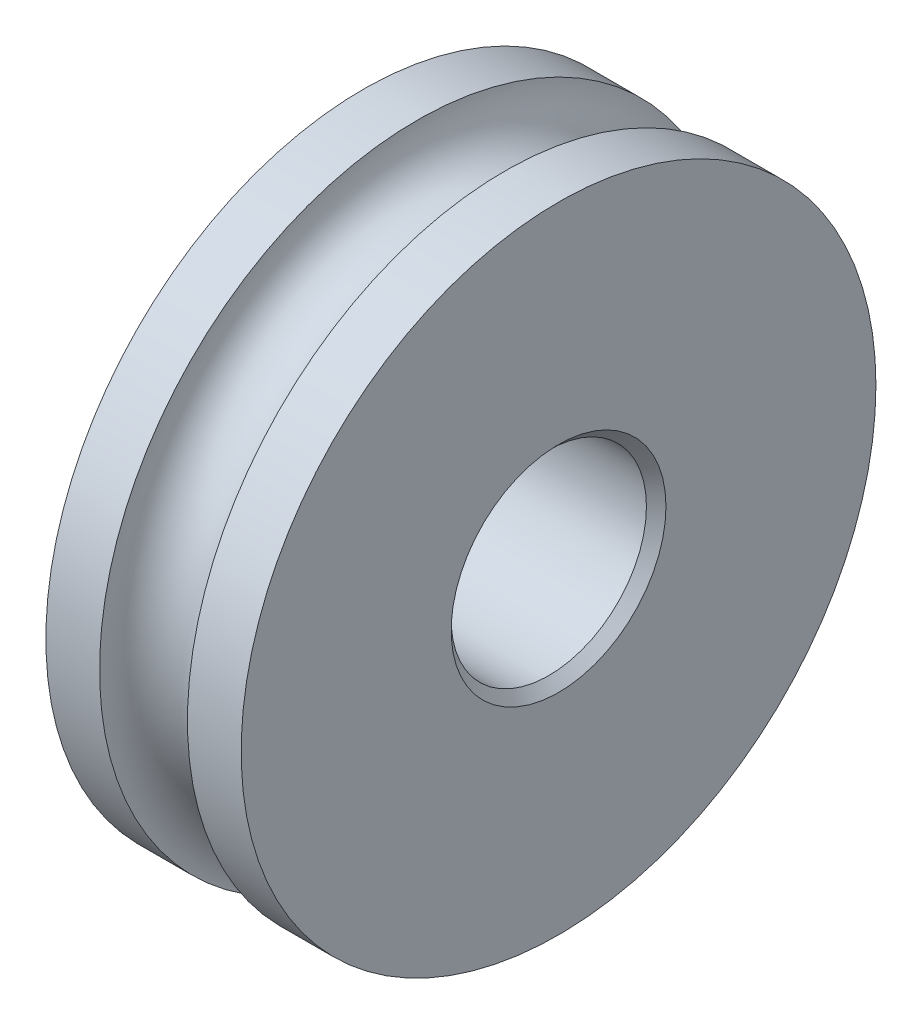
from build123d import *

# Parameters (mm, degrees)
CHAMFER_1_SIZE = 0.2


with BuildPart() as part:
    # Эскиз3 → Повернуть1 (revolve)
    with BuildSketch(Plane.XY):
        with BuildLine():
            Line((0, 2), (4, 2))
            Line((4, 2), (4, 6.5))
            Line((4, 6.5), (2.9, 6.5))
            ThreePointArc((2.9, 6.5), (2, 5.6), (1.1, 6.5))
            Line((1.1, 6.5), (0, 6.5))
            Line((0, 6.5), (0, 2))
        make_face()
    revolve(axis=Axis((7.18815516, 0, 0), (-1, 0, 0)))

    # Фаска1
    chamfer_1_edges = [part.edges().sort_by_distance(p)[0] for p in [
        (0, -2, 0),
        (4, -2, 0),
    ]]
    chamfer(chamfer_1_edges, length=CHAMFER_1_SIZE)


solid = part.part
